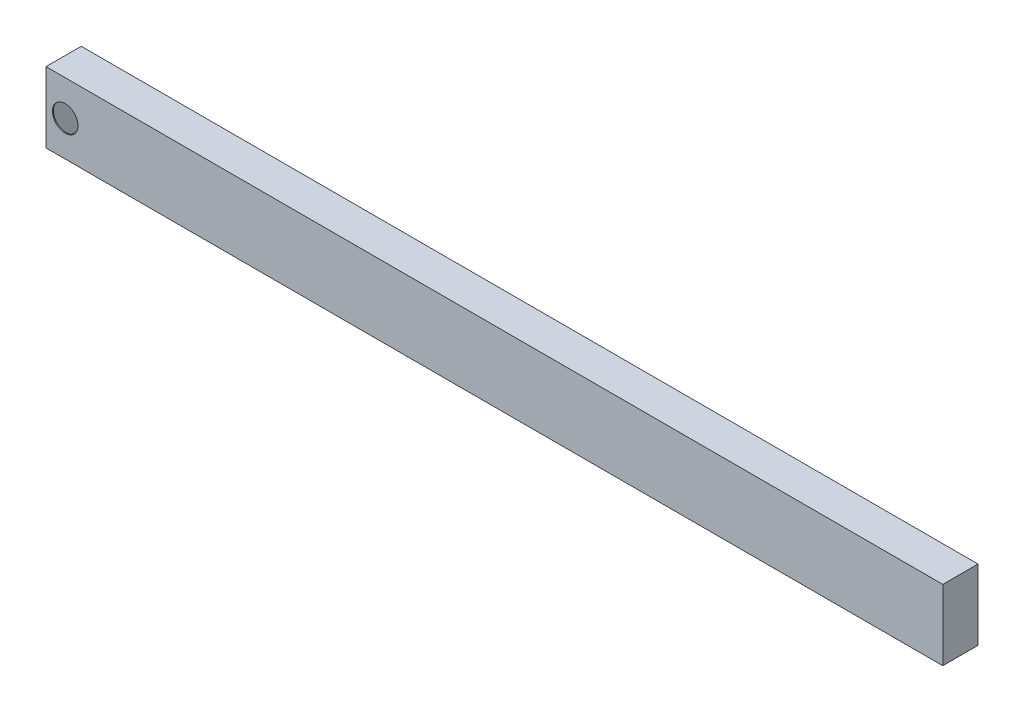
from build123d import *

# Parameters (mm, degrees)
SKETCH_1_W                = 1400
SKETCH_1_H                = 55
EXTRUDE_1_DEPTH           = 110
CUT_EXTRUDE_START         = -10
CUT_EXTRUDE_1_OUTLINE_R   = 30
CUT_EXTRUDE_1_OUTLINE_R_2 = 2.5
CUT_EXTRUDE_1_DEPTH       = 10
CUT_EXTRUDE_START_2       = -3
SKETCH_4_W                = 52
SKETCH_4_H                = 107
CUT_EXTRUDE_2_DEPTH       = 1394
SKETCH_5_R                = 20
CUT_EXTRUDE_3_DEPTH       = 10
EXTRUDE_START             = -45
SKETCH_7_R                = 30
EXTRUDE_2_DEPTH           = 52
SKETCH_8_R                = 27
CUT_EXTRUDE_4_DEPTH       = 47
PATTERN_LINEAR_1_COUNT    = 10
PATTERN_LINEAR_1_PITCH    = 155


# Read off the part's stored shape, not the designer's step: Вырез-Вытянуть1
with BuildPart() as part:
    # Эскиз1 → Бобышка-Вытянуть1 (new body)
    with BuildSketch(Plane(origin=(0, 0, 0), x_dir=(1, 0, 0), z_dir=(0, 1, 0))):
        with Locations((-700, 27.5)):
            Rectangle(SKETCH_1_W, SKETCH_1_H)
    extrude(amount=EXTRUDE_1_DEPTH)

    # Вырез-Вытянуть1 outline → Вырез-Вытянуть1 (cut)
    with BuildSketch(Plane(origin=(0, 0, -55), x_dir=(-1, 0, 0), z_dir=(0, 0, -1)).offset(CUT_EXTRUDE_START)):
        with Locations((60, 55)):
            Circle(CUT_EXTRUDE_1_OUTLINE_R)
        with Locations((15, 95)):
            Circle(CUT_EXTRUDE_1_OUTLINE_R_2)
        with Locations((1300, 55)):
            Circle(CUT_EXTRUDE_1_OUTLINE_R)
        with Locations((1145, 55)):
            Circle(CUT_EXTRUDE_1_OUTLINE_R)
        with Locations((990, 55)):
            Circle(CUT_EXTRUDE_1_OUTLINE_R)
        with Locations((835, 55)):
            Circle(CUT_EXTRUDE_1_OUTLINE_R)
        with Locations((680, 55)):
            Circle(CUT_EXTRUDE_1_OUTLINE_R)
        with Locations((525, 55)):
            Circle(CUT_EXTRUDE_1_OUTLINE_R)
        with Locations((370, 55)):
            Circle(CUT_EXTRUDE_1_OUTLINE_R)
        with Locations((215, 55)):
            Circle(CUT_EXTRUDE_1_OUTLINE_R)
        with Locations((15, 15)):
            Circle(CUT_EXTRUDE_1_OUTLINE_R_2)
    extrude(amount=CUT_EXTRUDE_1_DEPTH, mode=Mode.SUBTRACT)

    # Эскиз4 → Вырез-Вытянуть2 (cut)
    with BuildSketch(Plane(origin=(0, 0, 0), x_dir=(0, 0, -1), z_dir=(1, 0, 0)).offset(CUT_EXTRUDE_START_2)):
        with Locations((27.5, 55)):
            Rectangle(SKETCH_4_W, SKETCH_4_H)
    extrude(amount=-CUT_EXTRUDE_2_DEPTH, mode=Mode.SUBTRACT)

    # Эскиз5 → Вырез-Вытянуть3 (cut)
    with BuildSketch(Plane.XY):
        with Locations((-1370, 55)):
            Circle(SKETCH_5_R)
    extrude(amount=-CUT_EXTRUDE_3_DEPTH, mode=Mode.SUBTRACT)

    # Эскиз7 → Бобышка-Вытянуть2 (add)
    with BuildSketch(Plane(origin=(0, 0, -55), x_dir=(-1, 0, 0), z_dir=(0, 0, -1)).offset(EXTRUDE_START)):
        with Locations((60, 55)):
            Circle(SKETCH_7_R)
    extrude_2 = extrude(amount=EXTRUDE_2_DEPTH)

    # Эскиз8 → Вырез-Вытянуть4 (cut)
    with BuildSketch(Plane(origin=(0, 0, -62), x_dir=(-1, 0, 0), z_dir=(0, 0, -1))):
        with Locations((60, 55)):
            Circle(SKETCH_8_R)
    cut_extrude_4 = extrude(amount=-CUT_EXTRUDE_4_DEPTH, mode=Mode.SUBTRACT)

    # Линейный массив1: Бобышка-Вытянуть2, Вырез-Вытянуть4 ×10, 1 skipped
    with Locations(*[(-i * PATTERN_LINEAR_1_PITCH, 0, 0) for i in range(1, PATTERN_LINEAR_1_COUNT) if i not in (9,)]):
        add(extrude_2)
        add(cut_extrude_4, mode=Mode.SUBTRACT)


solid = part.part
